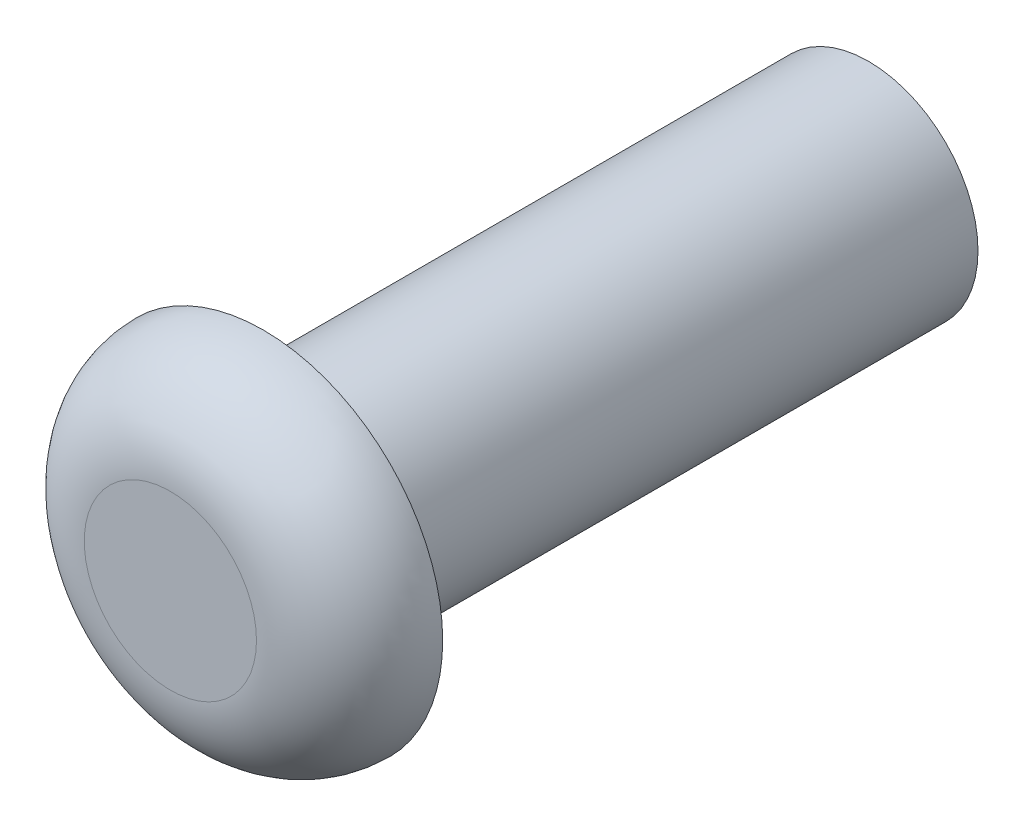
from build123d import *

# Parameters (mm, degrees)
SZKIC1_R                    = 2.35
DODANIE_WYCI_GNI_CIE1_DEPTH = 13
SZKIC3_R                    = 3.85
DODANIE_WYCI_GNI_CIE2_DEPTH = 2
ZAOKR_GLENIE1_R             = 2


with BuildPart() as part:
    # Szkic1 → Dodanie-wyciągnięcie1 (new body)
    with BuildSketch(Plane.XY):
        with Locations(Location((0, 0, 0), (0, 0, 180))):
            Circle(SZKIC1_R)
    extrude(amount=DODANIE_WYCI_GNI_CIE1_DEPTH)

    # Szkic3 → Dodanie-wyciągnięcie2 (add)
    with BuildSketch(Plane.XY.offset(13)):
        Circle(SZKIC3_R)
    extrude(amount=DODANIE_WYCI_GNI_CIE2_DEPTH)

    # Zaokrąglenie1
    zaokr_glenie1_edges = [part.edges().sort_by_distance(p)[0] for p in [
        (-3.85, 0, 15),
    ]]
    fillet(zaokr_glenie1_edges, radius=ZAOKR_GLENIE1_R - 0.0001)  # a hair under: the kernel refuses the full size


solid = part.part
